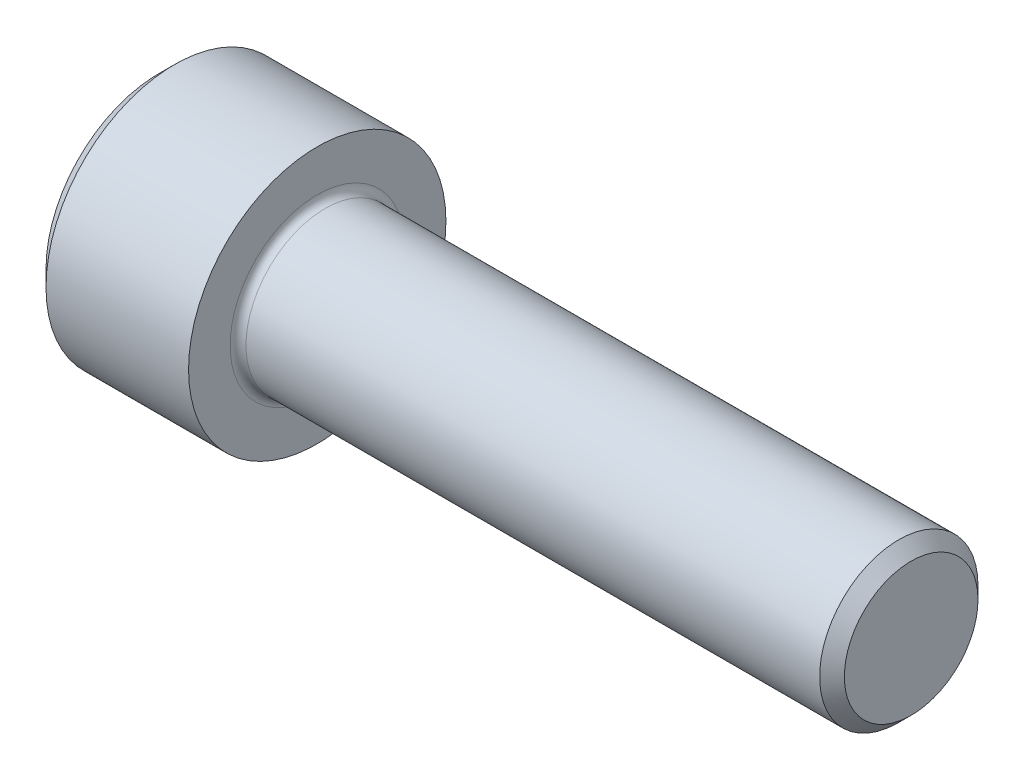
from build123d import *

# Parameters (mm, degrees)
CHAMFER1_SIZE      = 0.625
CUT_EXTRUDE1_DEPTH = 4
CHAMFER2_SIZE      = 0.8
FILLET1_R          = 0.4


with BuildPart() as part:
    # Sketch1 → Revolve1 (revolve)
    with BuildSketch(Plane(origin=(0, 0, 0), x_dir=(1, 0, 0), z_dir=(0, 1, 0))):
        Polygon((0, 0), (0, 6.5), (8, 6.5), (8, 4), (38, 4), (38, 0), align=None)
    revolve(axis=Axis((38, 0, 0), (-1, 0, 0)))

    # Chamfer1
    chamfer1_edges = [part.edges().sort_by_distance(p)[0] for p in [
        (38, 0, 4),
    ]]
    chamfer(chamfer1_edges, length=CHAMFER1_SIZE)

    # Sketch3 → Cut-Revolve1 (revolve, cut)
    with BuildSketch(Plane(origin=(0, 0, 0), x_dir=(1, 0, 0), z_dir=(0, 1, 0))):
        Polygon((0, 0), (5.732050808, 0), (4, 3), (0, 3), align=None)
    revolve(axis=Axis((0, 0, 0), (1, 0, 0)), mode=Mode.SUBTRACT)

    # Sketch2 → Cut-Extrude1 (cut)
    with BuildSketch(Plane.ZY):
        Polygon((0, 3.464101615), (-3, 1.732050808), (-3, -1.732050808), (0, -3.464101615), (3, -1.732050808), (3, 1.732050808), align=None)
    extrude(amount=-CUT_EXTRUDE1_DEPTH, mode=Mode.SUBTRACT)

    # Chamfer2
    chamfer2_edges = [part.edges().sort_by_distance(p)[0] for p in [
        (0, 0, 6.5),
    ]]
    chamfer(chamfer2_edges, length=CHAMFER2_SIZE)

    # Fillet1
    fillet1_edges = [part.edges().sort_by_distance(p)[0] for p in [
        (8, 0, 4),
    ]]
    fillet(fillet1_edges, radius=FILLET1_R)


solid = part.part
